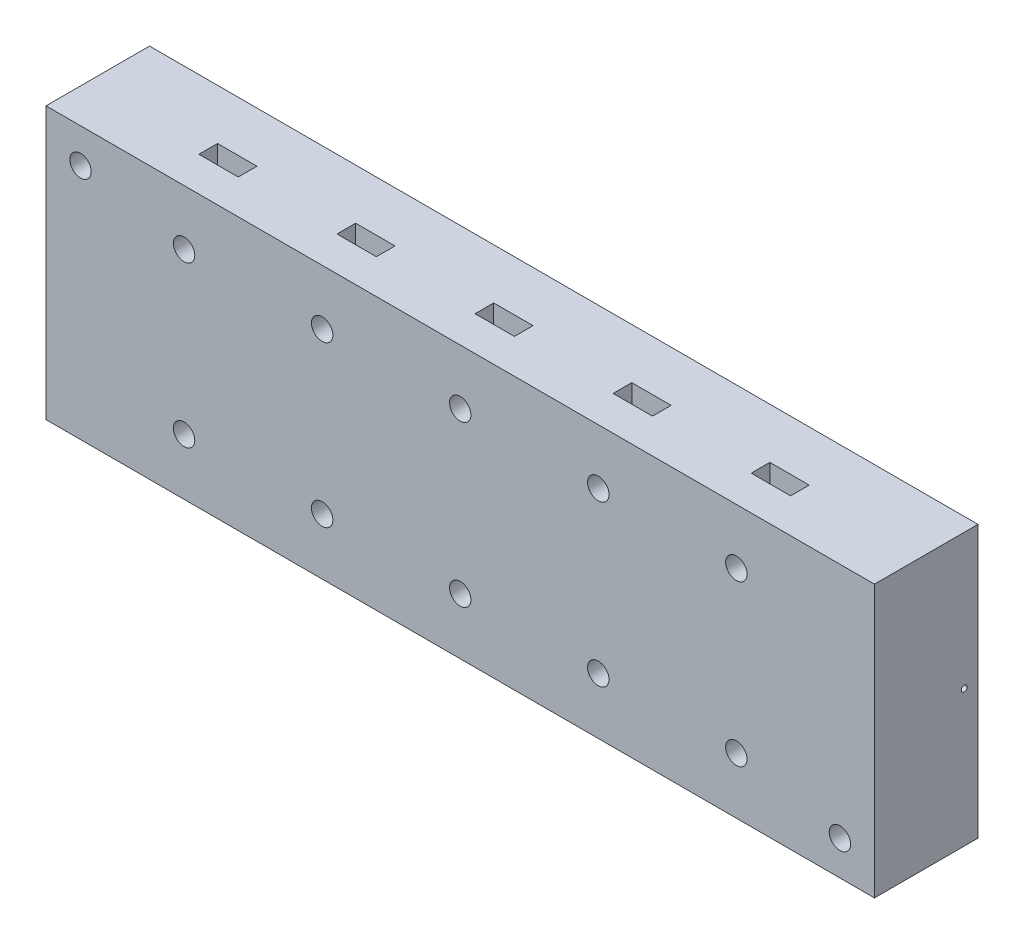
from build123d import *

# Parameters (mm, degrees)
SKIZZE2_W                        = 120
SKIZZE2_H                        = 39.364160046
AUFSATZ_LINEAR_AUSTRAGEN1_DEPTH  = 30
SKIZZE24_R                       = 1.55
SCHNITT_LINEAR_AUSTRAGEN4_DEPTH  = 130.805766806
SKIZZE46_R                       = 2.85
SCHNITT_LINEAR_AUSTRAGEN15_DEPTH = 10
SCHNITT_LINEAR_START             = -5
SCHNITT_LINEAR_AUSTRAGEN25_DEPTH = 2.7
LINEARES_MUSTER1_COUNT           = 5
LINEARES_MUSTER1_PITCH           = 20
SPIEGELN2_COPY_1_SKETCH_R        = 2.85
SPIEGELN2_COPY_1_DEPTH           = 10
SPIEGELN2_COPY_2_SKETCH_R        = 2.85
SPIEGELN2_COPY_2_DEPTH           = 10
SPIEGELN2_COPY_3_SKETCH_R        = 2.85
SPIEGELN2_COPY_3_DEPTH           = 10
SPIEGELN2_COPY_4_SKETCH_R        = 2.85
SPIEGELN2_COPY_4_DEPTH           = 10
SPIEGELN2_START                  = -5
SPIEGELN2_COPY_5_DEPTH           = 2.7
SPIEGELN2_COPY_6_DEPTH           = 2.7
SPIEGELN2_COPY_7_DEPTH           = 2.7
SPIEGELN2_COPY_8_DEPTH           = 2.7
SKIZZE51_R                       = 1.55
SCHNITT_LINEAR_AUSTRAGEN26_DEPTH = 130.805766806
SKIZZE67_R                       = 0.425
SCHNITT_LINEAR_AUSTRAGEN30_DEPTH = 20
SKIZZE70_R                       = 0.5
SCHNITT_LINEAR_AUSTRAGEN37_DEPTH = 16
SKIZZE71_R                       = 2
SCHNITT_LINEAR_AUSTRAGEN38_DEPTH = 6
ABSPALTEN3_OUTLINE_W             = 120
ABSPALTEN3_OUTLINE_H             = 39.364160046
ABSPALTEN3_OUTLINE_R             = 1.55
ABSPALTEN3_DEPTH                 = 15


# Read off the part's stored shape, not the designer's step: Abspalten3
with BuildPart() as part:
    # Skizze2 → Aufsatz-Linear austragen1 (new body)
    with BuildSketch(Plane.XY):
        with Locations((60, 19.682080023)):
            Rectangle(SKIZZE2_W, SKIZZE2_H)
    extrude(amount=AUFSATZ_LINEAR_AUSTRAGEN1_DEPTH)

    # Skizze24 → Schnitt-Linear austragen4 (cut, through all)
    with BuildSketch(Plane.XY.offset(30)):
        with Locations((20, 31.364160046)):
            Circle(SKIZZE24_R)
        with Locations((40, 31.364160046)):
            Circle(SKIZZE24_R)
        with Locations((60, 31.364160046)):
            Circle(SKIZZE24_R)
        with Locations((80, 31.364160046)):
            Circle(SKIZZE24_R)
        with Locations((100, 31.364160046)):
            Circle(SKIZZE24_R)
    schnitt_linear_austragen4 = extrude(amount=-SCHNITT_LINEAR_AUSTRAGEN4_DEPTH, mode=Mode.SUBTRACT)

    # Skizze46 → Schnitt-Linear austragen15 (cut)
    with BuildSketch(Plane(origin=(0, 0, 0), x_dir=(-1, 0, 0), z_dir=(0, 0, -1))):
        with Locations((-100, 31.364160046)):
            Circle(SKIZZE46_R)
    schnitt_linear_austragen15 = extrude(amount=-SCHNITT_LINEAR_AUSTRAGEN15_DEPTH, mode=Mode.SUBTRACT)

    # Skizze50 → Schnitt-Linear austragen25 (cut)
    with BuildSketch(Plane.XY.offset(30).offset(SCHNITT_LINEAR_START)):
        Polygon((97.15, 33.009608314), (97.15, 39.364160046), (102.85, 39.364160046), (102.85, 33.009608314), (102.85, 29.718711779), (100, 28.073263512), (97.15, 29.718711779), align=None)
    schnitt_linear_austragen25 = extrude(amount=-SCHNITT_LINEAR_AUSTRAGEN25_DEPTH, mode=Mode.SUBTRACT)

    # Lineares Muster1: Schnitt-Linear austragen15, Schnitt-Linear austragen25 ×5
    with Locations(*[(-i * LINEARES_MUSTER1_PITCH, 0, 0) for i in range(1, LINEARES_MUSTER1_COUNT)]):
        add(schnitt_linear_austragen15, mode=Mode.SUBTRACT)
        add(schnitt_linear_austragen25, mode=Mode.SUBTRACT)

    # Spiegeln2: Schnitt-Linear austragen15, Schnitt-Linear austragen25 across plane
    add(schnitt_linear_austragen15.mirror(Plane.ZX.offset(19.764160046)), mode=Mode.SUBTRACT)
    add(schnitt_linear_austragen25.mirror(Plane.ZX.offset(19.764160046)), mode=Mode.SUBTRACT)

    # Spiegeln2 copy 1 sketch → Spiegeln2 copy 1 (cut)
    with BuildSketch(Plane(origin=(-20, 39.528320093, 0), x_dir=(-1, 0, 0), z_dir=(0, 0, -1))):
        with Locations((-100, -31.364160046)):
            Circle(SPIEGELN2_COPY_1_SKETCH_R)
    extrude(amount=-SPIEGELN2_COPY_1_DEPTH, mode=Mode.SUBTRACT)

    # Spiegeln2 copy 2 sketch → Spiegeln2 copy 2 (cut)
    with BuildSketch(Plane(origin=(-40, 39.528320093, 0), x_dir=(-1, 0, 0), z_dir=(0, 0, -1))):
        with Locations((-100, -31.364160046)):
            Circle(SPIEGELN2_COPY_2_SKETCH_R)
    extrude(amount=-SPIEGELN2_COPY_2_DEPTH, mode=Mode.SUBTRACT)

    # Spiegeln2 copy 3 sketch → Spiegeln2 copy 3 (cut)
    with BuildSketch(Plane(origin=(-60, 39.528320093, 0), x_dir=(-1, 0, 0), z_dir=(0, 0, -1))):
        with Locations((-100, -31.364160046)):
            Circle(SPIEGELN2_COPY_3_SKETCH_R)
    extrude(amount=-SPIEGELN2_COPY_3_DEPTH, mode=Mode.SUBTRACT)

    # Spiegeln2 copy 4 sketch → Spiegeln2 copy 4 (cut)
    with BuildSketch(Plane(origin=(-80, 39.528320093, 0), x_dir=(-1, 0, 0), z_dir=(0, 0, -1))):
        with Locations((-100, -31.364160046)):
            Circle(SPIEGELN2_COPY_4_SKETCH_R)
    extrude(amount=-SPIEGELN2_COPY_4_DEPTH, mode=Mode.SUBTRACT)

    # Spiegeln2 copy 5 sketch → Spiegeln2 copy 5 (cut)
    with BuildSketch(Plane(origin=(-20, 39.528320093, 30), x_dir=(1, 0, 0), z_dir=(0, 0, 1)).offset(SPIEGELN2_START)):
        Polygon((97.15, -33.009608314), (97.15, -39.364160046), (102.85, -39.364160046), (102.85, -33.009608314), (102.85, -29.718711779), (100, -28.073263512), (97.15, -29.718711779), align=None)
    extrude(amount=-SPIEGELN2_COPY_5_DEPTH, mode=Mode.SUBTRACT)

    # Spiegeln2 copy 6 sketch → Spiegeln2 copy 6 (cut)
    with BuildSketch(Plane(origin=(-40, 39.528320093, 30), x_dir=(1, 0, 0), z_dir=(0, 0, 1)).offset(SPIEGELN2_START)):
        Polygon((97.15, -33.009608314), (97.15, -39.364160046), (102.85, -39.364160046), (102.85, -33.009608314), (102.85, -29.718711779), (100, -28.073263512), (97.15, -29.718711779), align=None)
    extrude(amount=-SPIEGELN2_COPY_6_DEPTH, mode=Mode.SUBTRACT)

    # Spiegeln2 copy 7 sketch → Spiegeln2 copy 7 (cut)
    with BuildSketch(Plane(origin=(-60, 39.528320093, 30), x_dir=(1, 0, 0), z_dir=(0, 0, 1)).offset(SPIEGELN2_START)):
        Polygon((97.15, -33.009608314), (97.15, -39.364160046), (102.85, -39.364160046), (102.85, -33.009608314), (102.85, -29.718711779), (100, -28.073263512), (97.15, -29.718711779), align=None)
    extrude(amount=-SPIEGELN2_COPY_7_DEPTH, mode=Mode.SUBTRACT)

    # Spiegeln2 copy 8 sketch → Spiegeln2 copy 8 (cut)
    with BuildSketch(Plane(origin=(-80, 39.528320093, 30), x_dir=(1, 0, 0), z_dir=(0, 0, 1)).offset(SPIEGELN2_START)):
        Polygon((97.15, -33.009608314), (97.15, -39.364160046), (102.85, -39.364160046), (102.85, -33.009608314), (102.85, -29.718711779), (100, -28.073263512), (97.15, -29.718711779), align=None)
    extrude(amount=-SPIEGELN2_COPY_8_DEPTH, mode=Mode.SUBTRACT)

    # Spiegeln3: Schnitt-Linear austragen4 across plane
    add(schnitt_linear_austragen4.mirror(Plane.ZX.offset(19.764160046)), mode=Mode.SUBTRACT)

    # Skizze51 → Schnitt-Linear austragen26 (cut, through all)
    with BuildSketch(Plane.XY.offset(30)):
        with Locations((5, 34.364160046)):
            Circle(SKIZZE51_R)
        with Locations((115, 5)):
            Circle(SKIZZE51_R)
    extrude(amount=-SCHNITT_LINEAR_AUSTRAGEN26_DEPTH, mode=Mode.SUBTRACT)

    # Skizze66 → Schnitt-Rotation5 (revolve, cut)
    with BuildSketch(Plane.XY.offset(15), mode=Mode.PRIVATE) as schnitt_rotation5_sk:
        Polygon((110, 19.682080023), (110, 21.182080023), (10, 22.682080023), (10, 19.682080023), align=None)
        Polygon((105, 19.682080023), (105, 22.257192517), (15, 23.607192517), (15, 19.682080023), align=None)
    revolve(schnitt_rotation5_sk.sketch.rotate(Axis((10, 19.682080023, 15), (1, 0, 0)), 180), axis=Axis((10, 19.682080023, 15), (1, 0, 0)), mode=Mode.SUBTRACT)

    # Skizze67 → Schnitt-Linear austragen30 (cut)
    with BuildSketch(Plane(origin=(120, 0, 0), x_dir=(0, 0, -1), z_dir=(1, 0, 0))):
        with Locations((-17, 19.764160046)):
            Circle(SKIZZE67_R)
    schnitt_linear_austragen30 = extrude(amount=-SCHNITT_LINEAR_AUSTRAGEN30_DEPTH, mode=Mode.SUBTRACT)

    # Spiegeln7: Schnitt-Linear austragen30 across plane
    add(schnitt_linear_austragen30.mirror(Plane.XY.offset(15)), mode=Mode.SUBTRACT)

    # Skizze70 → Schnitt-Linear austragen37 (cut)
    with BuildSketch(Plane.ZY):
        with Locations((11.58373564, 19.764160046)):
            Circle(SKIZZE70_R)
    extrude(amount=-SCHNITT_LINEAR_AUSTRAGEN37_DEPTH, mode=Mode.SUBTRACT)

    # Skizze71 → Schnitt-Linear austragen38 (cut)
    with BuildSketch(Plane.ZY):
        with Locations((11.58373564, 19.764160046)):
            Circle(SKIZZE71_R)
    extrude(amount=-SCHNITT_LINEAR_AUSTRAGEN38_DEPTH, mode=Mode.SUBTRACT)

    # Abspalten3 outline → Abspalten3 (cut)
    with BuildSketch(Plane.XY):
        with Locations((60, 19.682080023)):
            Rectangle(ABSPALTEN3_OUTLINE_W, ABSPALTEN3_OUTLINE_H)
        with Locations((115, 5)):
            Circle(ABSPALTEN3_OUTLINE_R, mode=Mode.SUBTRACT)
        with Locations((5, 34.364160046)):
            Circle(ABSPALTEN3_OUTLINE_R, mode=Mode.SUBTRACT)
        with Locations((20, 8.164160046)):
            Circle(ABSPALTEN3_OUTLINE_R, mode=Mode.SUBTRACT)
        with Locations((40, 8.164160046)):
            Circle(ABSPALTEN3_OUTLINE_R, mode=Mode.SUBTRACT)
        with Locations((60, 8.164160046)):
            Circle(ABSPALTEN3_OUTLINE_R, mode=Mode.SUBTRACT)
        with Locations((80, 8.164160046)):
            Circle(ABSPALTEN3_OUTLINE_R, mode=Mode.SUBTRACT)
        with Locations((100, 8.164160046)):
            Circle(ABSPALTEN3_OUTLINE_R, mode=Mode.SUBTRACT)
        with Locations((20, 31.364160046)):
            Circle(ABSPALTEN3_OUTLINE_R, mode=Mode.SUBTRACT)
        with Locations((40, 31.364160046)):
            Circle(ABSPALTEN3_OUTLINE_R, mode=Mode.SUBTRACT)
        with Locations((60, 31.364160046)):
            Circle(ABSPALTEN3_OUTLINE_R, mode=Mode.SUBTRACT)
        with Locations((80, 31.364160046)):
            Circle(ABSPALTEN3_OUTLINE_R, mode=Mode.SUBTRACT)
        with Locations((100, 31.364160046)):
            Circle(ABSPALTEN3_OUTLINE_R, mode=Mode.SUBTRACT)
    extrude(amount=ABSPALTEN3_DEPTH, mode=Mode.SUBTRACT)


solid = part.part
